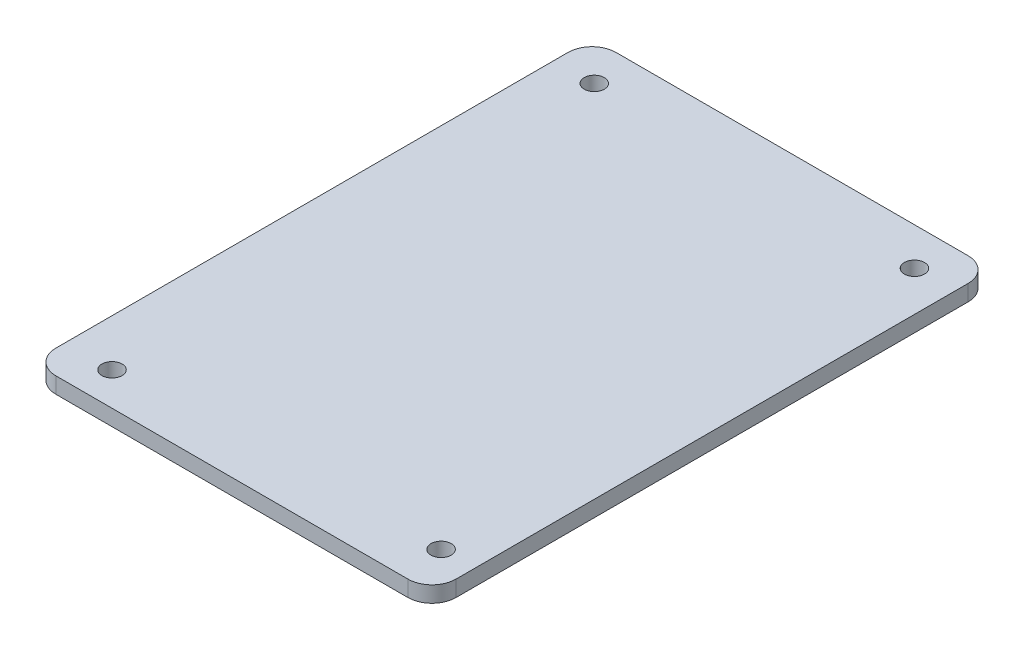
from build123d import *

# Parameters (mm, degrees)
SKETCH_1_W      = 50
SKETCH_1_H      = 70
SKETCH_1_R      = 1.26
EXTRUDE_1_DEPTH = 2
FILLET_1_R      = 3


with BuildPart() as part:
    # 草图1 → 凸台-拉伸1 (new body)
    with BuildSketch(Plane(origin=(0, 0, 0), x_dir=(1, 0, 0), z_dir=(0, 1, 0))):
        Rectangle(SKETCH_1_W, SKETCH_1_H)
        with Locations((20.007928333, 30.287601739)):
            Circle(SKETCH_1_R, mode=Mode.SUBTRACT)
        with Locations((-20.007928333, 30.287601739)):
            Circle(SKETCH_1_R, mode=Mode.SUBTRACT)
        with Locations((20.852563508, -29.712398261)):
            Circle(SKETCH_1_R, mode=Mode.SUBTRACT)
        with Locations((-19.147436492, -30.838801713)):
            Circle(SKETCH_1_R, mode=Mode.SUBTRACT)
    extrude(amount=EXTRUDE_1_DEPTH)

    # 圆角1
    fillet_1_edges = [part.edges().sort_by_distance(p)[0] for p in [
        (-25, 1, -35),
        (25, 1, -35),
        (-25, 1, 35),
        (25, 1, 35),
    ]]
    fillet(fillet_1_edges, radius=FILLET_1_R)


solid = part.part
